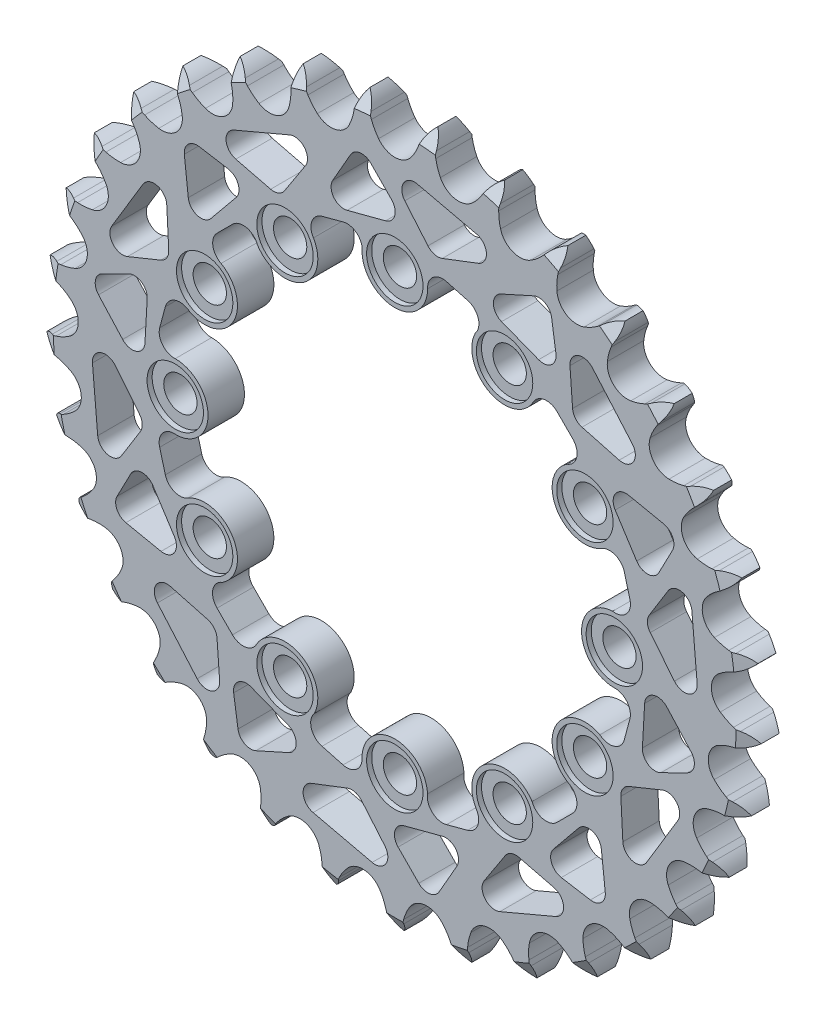
from build123d import *

# Parameters (mm, degrees)
EXTRUSION_DEPTH         = 7.2136
CIRPATTERN1_COUNT       = 12
CUT_EXTRUDE1_DEPTH      = 101.397293257
CUT_EXTRUDE1_DEPTH_BACK = 101.397293257
SKETCH8_R               = 37
CUT_EXTRUDE2_START      = 7.2136
SKETCH10_R              = 5.588
CUT_EXTRUDE2_DEPTH      = 1.016
CIRPATTERN2_COUNT       = 12
CUT_EXTRUDE3_DEPTH      = 101.397293405
CIRPATTERN3_COUNT       = 12
CUT_EXTRUDE4_DEPTH      = 101.397293405
CIRPATTERN5_COUNT       = 10


with BuildPart() as part:
    # Teeth Sketch → Extrusion (new body)
    with BuildSketch(Plane.XY):
        with BuildLine():
            Line((5.022388138, 68.006393031), (4.635162245, 66.971544668))
            ThreePointArc((4.635162245, 66.971544668), (4.0137299, 65.635158722), (3.209237245, 64.400291471))
            ThreePointArc((3.209237245, 64.400291471), (0, 62.793862006), (-3.209237245, 64.400291471))
            ThreePointArc((-3.209237245, 64.400291471), (-4.0137299, 65.635158722), (-4.635162245, 66.971544668))
            Line((-4.635162245, 66.971544668), (-5.022388138, 68.006393031))
            ThreePointArc((-5.022388138, 68.006393031), (-5.727412099, 69.369502295), (-6.734552875, 70.527428506))
            ThreePointArc((-6.734552875, 70.527428506), (-7.504354329, 69.199824885), (-7.938667464, 67.727922119))
            Line((-7.938667464, 67.727922119), (-8.123049341, 66.638491832))
            ThreePointArc((-8.123049341, 66.638491832), (-8.48033889, 65.208649276), (-9.036593151, 63.84384645))
            ThreePointArc((-9.036593151, 63.84384645), (-11.883816523, 61.659095115), (-15.339077445, 62.629142165))
            ThreePointArc((-15.339077445, 62.629142165), (-16.362732034, 63.68944252), (-17.22584699, 64.884071387))
            Line((-17.22584699, 64.884071387), (-17.801921547, 65.826935709))
            ThreePointArc((-17.801921547, 65.826935709), (-18.752174931, 67.031985151), (-19.960254337, 67.978383482))
            ThreePointArc((-19.960254337, 67.978383482), (-20.464893839, 66.529085505), (-20.61279894, 65.001587639))
            Line((-20.61279894, 65.001587639), (-20.587672758, 63.896950277))
            ThreePointArc((-20.587672758, 63.896950277), (-20.667906137, 62.425329346), (-20.955817525, 60.979918474))
            ThreePointArc((-20.955817525, 60.979918474), (-23.338120953, 58.295807876), (-26.914523421, 58.594412483))
            ThreePointArc((-26.914523421, 58.594412483), (-28.120342399, 59.441823925), (-29.193944743, 60.451518712))
            Line((-29.193944743, 60.451518712), (-29.938047129, 61.268321421))
            ThreePointArc((-29.938047129, 61.268321421), (-31.099185303, 62.271757414), (-32.464540202, 62.972422563))
            ThreePointArc((-32.464540202, 62.972422563), (-32.685778765, 61.453811636), (-32.541930156, 59.925926421))
            Line((-32.541930156, 59.925926421), (-32.308204042, 58.846006456))
            ThreePointArc((-32.308204042, 58.846006456), (-32.108481407, 57.385795366), (-32.117644055, 55.912017363))
            ThreePointArc((-32.117644055, 55.912017363), (-33.948924886, 52.825558252), (-37.517208396, 52.441928068))
            ThreePointArc((-37.517208396, 52.441928068), (-38.861610323, 53.045822938), (-40.106897269, 53.834090646))
            Line((-40.106897269, 53.834090646), (-40.992133685, 54.495310364))
            ThreePointArc((-40.992133685, 54.495310364), (-42.32219009, 55.260866117), (-43.795472998, 55.69047422))
            ThreePointArc((-43.795472998, 55.69047422), (-43.725314484, 54.157436897), (-43.294911229, 52.684386087))
            Line((-43.294911229, 52.684386087), (-42.861032653, 51.668214641))
            ThreePointArc((-42.861032653, 51.668214641), (-42.388572501, 50.272189225), (-42.118655247, 48.823310267))
            ThreePointArc((-42.118655247, 48.823310267), (-43.33272622, 45.446055318), (-46.763923708, 44.394055736))
            ThreePointArc((-46.763923708, 44.394055736), (-48.198318397, 44.732607702), (-49.570282031, 45.270958281))
            Line((-49.570282031, 45.270958281), (-50.564657725, 45.752696804))
            ThreePointArc((-50.564657725, 45.752696804), (-52.015560657, 46.252703137), (-53.543523293, 46.395727039))
            ThreePointArc((-53.543523293, 46.395727039), (-53.184503413, 44.903671283), (-52.483101407, 43.538694772))
            Line((-52.483101407, 43.538694772), (-51.864751871, 42.622998928))
            ThreePointArc((-51.864751871, 42.622998928), (-51.136630142, 41.341615182), (-50.597388499, 39.970001531))
            ThreePointArc((-50.597388499, 39.970001531), (-51.150369926, 36.424013535), (-54.320468976, 34.741666562))
            ThreePointArc((-54.320468976, 34.741666562), (-55.793013665, 34.802639473), (-57.242067645, 35.071615531))
            Line((-57.242067645, 35.071615531), (-58.309643291, 35.356461573))
            ThreePointArc((-58.309643291, 35.356461573), (-59.828953337, 35.572846956), (-61.356371149, 35.424117399))
            ThreePointArc((-61.356371149, 35.424117399), (-60.721465817, 34.026969994), (-59.774415556, 32.819401589))
            Line((-59.774415556, 32.819401589), (-58.993943824, 32.037276981))
            ThreePointArc((-58.993943824, 32.037276981), (-58.036476735, 30.916847451), (-57.2474003, 29.672072798))
            ThreePointArc((-57.2474003, 29.672072798), (-57.119305992, 26.085513002), (-59.913730964, 23.83362304))
            ThreePointArc((-59.913730964, 23.83362304), (-61.371204052, 23.614813176), (-62.844975793, 23.604693218))
            Line((-62.844975793, 23.604693218), (-63.947166423, 23.682351702))
            ThreePointArc((-63.947166423, 23.682351702), (-65.479971761, 23.607295402), (-66.951639889, 23.17218786))
            ThreePointArc((-66.951639889, 23.17218786), (-66.063796239, 21.920445353), (-64.905326586, 20.913929722))
            Line((-64.905326586, 20.913929722), (-63.99094094, 20.293644371))
            ThreePointArc((-63.99094094, 20.293644371), (-62.838733846, 19.374664301), (-61.828341898, 18.301718044))
            ThreePointArc((-61.828341898, 18.301718044), (-61.023801517, 14.804214063), (-63.341554612, 12.064170283))
            ThreePointArc((-63.341554612, 12.064170283), (-64.731279223, 11.573486003), (-66.176502774, 11.28463579))
            Line((-66.176502774, 11.28463579), (-67.273472348, 11.152299936))
            ThreePointArc((-67.273472348, 11.152299936), (-68.764373399, 10.788514683), (-70.127101923, 10.082755077))
            ThreePointArc((-70.127101923, 10.082755077), (-69.018408937, 9.021658703), (-67.690390004, 8.252573944))
            Line((-67.690390004, 8.252573944), (-66.675138724, 7.816546579))
            ThreePointArc((-66.675138724, 7.816546579), (-65.369835391, 7.132230303), (-64.174646128, 6.269891516))
            ThreePointArc((-64.174646128, 6.269891516), (-62.722737859, 2.987852256), (-64.480049441, -0.14131302))
            ThreePointArc((-64.480049441, -0.14131302), (-65.751797307, -0.886137108), (-67.116238523, -1.443277777))
            Line((-67.116238523, -1.443277777), (-68.168339704, -1.780825007))
            ThreePointArc((-68.168339704, -1.780825007), (-69.563451418, -2.420191065), (-70.767987779, -3.371094744))
            ThreePointArc((-70.767987779, -3.371094744), (-69.478516511, -4.203194198), (-68.028946362, -4.707051357))
            Line((-68.028946362, -4.707051357), (-66.949523274, -4.943061572))
            ThreePointArc((-66.949523274, -4.943061572), (-65.538300765, -5.367981082), (-64.201511441, -5.988545228))
            ThreePointArc((-64.201511441, -5.988545228), (-62.154711032, -8.936498316), (-63.288067282, -12.341688903))
            ThreePointArc((-63.288067282, -12.341688903), (-64.395874122, -13.313732915), (-65.630218543, -14.119027525))
            Line((-65.630218543, -14.119027525), (-66.599425651, -14.649586294))
            ThreePointArc((-66.599425651, -14.649586294), (-67.848325057, -15.541424803), (-68.851134172, -16.703104419))
            ThreePointArc((-68.851134172, -16.703104419), (-67.427489473, -17.276132709), (-65.908759351, -17.496551559))
            Line((-65.908759351, -17.496551559), (-64.804177617, -17.524014599))
            ThreePointArc((-64.804177617, -17.524014599), (-63.338041192, -17.674179644), (-61.907966855, -18.030540344))
            ThreePointArc((-61.907966855, -18.030540344), (-59.340251006, -20.537860555), (-59.808689476, -24.096003993))
            ThreePointArc((-59.808689476, -24.096003993), (-60.712516265, -25.260135726), (-61.772151467, -26.284478831))
            Line((-61.772151467, -26.284478831), (-62.623434833, -26.988873364))
            ThreePointArc((-62.623434833, -26.988873364), (-63.680983452, -28.100950955), (-64.445821187, -29.43142038))
            ThreePointArc((-64.445821187, -29.43142038), (-62.939457285, -29.724666771), (-61.406458053, -29.6536808))
            Line((-61.406458053, -29.6536808), (-60.316640136, -29.471604079))
            ThreePointArc((-60.316640136, -29.471604079), (-58.848579784, -29.341587304), (-57.376907048, -29.420864754))
            ThreePointArc((-57.376907048, -29.420864754), (-54.381079699, -31.396931003), (-54.167669802, -34.979426717))
            ThreePointArc((-54.167669802, -34.979426717), (-54.834849884, -36.293571418), (-55.681477891, -37.499940589))
            Line((-55.681477891, -37.499940589), (-56.384069915, -38.352712231))
            ThreePointArc((-56.384069915, -38.352712231), (-57.212045185, -39.644835523), (-57.711268312, -41.096008126))
            ThreePointArc((-57.711268312, -41.096008126), (-56.176629123, -41.09887393), (-54.684767369, -40.739048756))
            Line((-54.684767369, -40.739048756), (-53.649102126, -40.354013001))
            ThreePointArc((-53.649102126, -40.354013001), (-52.232177374, -39.94851355), (-50.772096325, -39.747842457))
            ThreePointArc((-50.772096325, -39.747842457), (-47.456434483, -41.12123456), (-46.56888941, -44.598601821))
            ThreePointArc((-46.56888941, -44.598601821), (-46.975309158, -46.015262876), (-47.578330627, -47.360056788))
            Line((-47.578330627, -47.360056788), (-48.106837804, -48.330384151))
            ThreePointArc((-48.106837804, -48.330384151), (-48.675314541, -49.755852442), (-48.890879835, -51.275279063))
            ThreePointArc((-48.890879835, -51.275279063), (-47.383431219, -50.987660703), (-45.986626711, -50.352001344))
            Line((-45.986626711, -50.352001344), (-45.042545785, -49.777922752))
            ThreePointArc((-45.042545785, -49.777922752), (-43.727967985, -49.111596431), (-42.332249756, -48.638229571))
            ThreePointArc((-42.332249756, -48.638229571), (-38.816590078, -49.35930956), (-37.28698802, -52.605867255))
            ThreePointArc((-37.28698802, -52.605867255), (-37.417958367, -54.073842843), (-37.75557853, -55.50845714))
            Line((-37.75557853, -55.50845714), (-38.090899233, -56.561270064))
            ThreePointArc((-38.090899233, -56.561270064), (-38.379331208, -58.068563217), (-38.303447577, -59.601327819))
            ThreePointArc((-38.303447577, -59.601327819), (-36.877672653, -59.03362057), (-35.626409548, -58.145101414))
            Line((-35.626409548, -58.145101414), (-34.808034481, -57.402728679))
            ThreePointArc((-34.808034481, -57.402728679), (-33.6433159, -56.499658259), (-32.362405386, -55.770704343))
            ThreePointArc((-32.362405386, -55.770704343), (-28.773812973, -55.813410509), (-26.657437732, -58.711819583))
            ThreePointArc((-26.657437732, -58.711819583), (-26.508225068, -60.178053241), (-26.568241455, -61.650637225))
            Line((-26.568241455, -61.650637225), (-26.69825632, -62.747884308))
            ThreePointArc((-26.69825632, -62.747884308), (-26.696218847, -64.28252482), (-26.331628924, -65.773229298))
            ThreePointArc((-26.331628924, -65.773229298), (-25.039058915, -64.94595158), (-23.978561119, -63.836686022))
            Line((-23.978561119, -63.836686022), (-23.31547012, -62.952850431))
            ThreePointArc((-23.31547012, -62.952850431), (-22.342706722, -61.845675228), (-21.222899365, -60.887480551))
            ThreePointArc((-21.222899365, -60.887480551), (-17.691075297, -60.250269381), (-15.06441819, -62.69577378))
            ThreePointArc((-15.06441819, -62.69577378), (-14.640415448, -64.107272002), (-14.42065891, -65.564602652))
            Line((-14.42065891, -65.564602652), (-14.340668861, -66.666626525))
            ThreePointArc((-14.340668861, -66.666626525), (-14.048235582, -68.17314849), (-13.408116596, -69.567914899))
            ThreePointArc((-13.408116596, -69.567914899), (-12.295468348, -68.510966685), (-11.464065017, -67.221046473))
            Line((-11.464065017, -67.221046473), (-10.980223921, -66.227692145))
            ThreePointArc((-10.980223921, -66.227692145), (-10.23457391, -64.956428358), (-9.316342465, -63.80362457))
            ThreePointArc((-9.316342465, -63.80362457), (-5.968936066, -62.509526537), (-2.926931324, -64.413739359))
            ThreePointArc((-2.926931324, -64.413739359), (-2.24346307, -65.719486924), (-1.751876179, -67.108892511))
            Line((-1.751876179, -67.108892511), (-1.464772265, -68.175863162))
            ThreePointArc((-1.464772265, -68.175863162), (-0.89251248, -69.59981695), (0, -70.848234798))
            ThreePointArc((0, -70.848234798), (0.89251248, -69.59981695), (1.464772265, -68.175863162))
            Line((1.464772265, -68.175863162), (1.751876179, -67.108892511))
            ThreePointArc((1.751876179, -67.108892511), (2.24346307, -65.719486924), (2.926931324, -64.413739359))
            ThreePointArc((2.926931324, -64.413739359), (5.968936066, -62.509526537), (9.316342465, -63.80362457))
            ThreePointArc((9.316342465, -63.80362457), (10.23457391, -64.956428358), (10.980223921, -66.227692145))
            Line((10.980223921, -66.227692145), (11.464065017, -67.221046473))
            ThreePointArc((11.464065017, -67.221046473), (12.295468348, -68.510966685), (13.408116596, -69.567914899))
            ThreePointArc((13.408116596, -69.567914899), (14.048235582, -68.17314849), (14.340668861, -66.666626525))
            Line((14.340668861, -66.666626525), (14.42065891, -65.564602652))
            ThreePointArc((14.42065891, -65.564602652), (14.640415448, -64.107272002), (15.06441819, -62.69577378))
            ThreePointArc((15.06441819, -62.69577378), (17.691075297, -60.250269381), (21.222899365, -60.887480551))
            ThreePointArc((21.222899365, -60.887480551), (22.342706722, -61.845675228), (23.31547012, -62.952850431))
            Line((23.31547012, -62.952850431), (23.978561119, -63.836686022))
            ThreePointArc((23.978561119, -63.836686022), (25.039058915, -64.94595158), (26.331628924, -65.773229298))
            ThreePointArc((26.331628924, -65.773229298), (26.696218847, -64.28252482), (26.69825632, -62.747884308))
            Line((26.69825632, -62.747884308), (26.568241455, -61.650637225))
            ThreePointArc((26.568241455, -61.650637225), (26.508225068, -60.178053241), (26.657437732, -58.711819583))
            ThreePointArc((26.657437732, -58.711819583), (28.773812973, -55.813410509), (32.362405386, -55.770704343))
            ThreePointArc((32.362405386, -55.770704343), (33.6433159, -56.499658259), (34.808034481, -57.402728679))
            Line((34.808034481, -57.402728679), (35.626409548, -58.145101414))
            ThreePointArc((35.626409548, -58.145101414), (36.877672653, -59.03362057), (38.303447577, -59.601327819))
            ThreePointArc((38.303447577, -59.601327819), (38.379331208, -58.068563217), (38.090899233, -56.561270064))
            Line((38.090899233, -56.561270064), (37.75557853, -55.50845714))
            ThreePointArc((37.75557853, -55.50845714), (37.417958367, -54.073842843), (37.28698802, -52.605867255))
            ThreePointArc((37.28698802, -52.605867255), (38.816590078, -49.35930956), (42.332249756, -48.638229571))
            ThreePointArc((42.332249756, -48.638229571), (43.727967985, -49.111596431), (45.042545785, -49.777922752))
            Line((45.042545785, -49.777922752), (45.986626711, -50.352001344))
            ThreePointArc((45.986626711, -50.352001344), (47.383431219, -50.987660703), (48.890879835, -51.275279063))
            ThreePointArc((48.890879835, -51.275279063), (48.675314541, -49.755852442), (48.106837804, -48.330384151))
            Line((48.106837804, -48.330384151), (47.578330627, -47.360056788))
            ThreePointArc((47.578330627, -47.360056788), (46.975309158, -46.015262876), (46.56888941, -44.598601821))
            ThreePointArc((46.56888941, -44.598601821), (47.456434483, -41.12123456), (50.772096325, -39.747842457))
            ThreePointArc((50.772096325, -39.747842457), (52.232177374, -39.94851355), (53.649102126, -40.354013001))
            Line((53.649102126, -40.354013001), (54.684767369, -40.739048756))
            ThreePointArc((54.684767369, -40.739048756), (56.176629123, -41.09887393), (57.711268312, -41.096008126))
            ThreePointArc((57.711268312, -41.096008126), (57.212045185, -39.644835523), (56.384069915, -38.352712231))
            Line((56.384069915, -38.352712231), (55.681477891, -37.499940589))
            ThreePointArc((55.681477891, -37.499940589), (54.834849884, -36.293571418), (54.167669802, -34.979426717))
            ThreePointArc((54.167669802, -34.979426717), (54.381079699, -31.396931003), (57.376907048, -29.420864754))
            ThreePointArc((57.376907048, -29.420864754), (58.848579784, -29.341587304), (60.316640136, -29.471604079))
            Line((60.316640136, -29.471604079), (61.406458053, -29.6536808))
            ThreePointArc((61.406458053, -29.6536808), (62.939457285, -29.724666771), (64.445821187, -29.43142038))
            ThreePointArc((64.445821187, -29.43142038), (63.680983452, -28.100950955), (62.623434833, -26.988873364))
            Line((62.623434833, -26.988873364), (61.772151467, -26.284478831))
            ThreePointArc((61.772151467, -26.284478831), (60.712516265, -25.260135726), (59.808689476, -24.096003993))
            ThreePointArc((59.808689476, -24.096003993), (59.340251006, -20.537860555), (61.907966855, -18.030540344))
            ThreePointArc((61.907966855, -18.030540344), (63.338041192, -17.674179644), (64.804177617, -17.524014599))
            Line((64.804177617, -17.524014599), (65.908759351, -17.496551559))
            ThreePointArc((65.908759351, -17.496551559), (67.427489473, -17.276132709), (68.851134172, -16.703104419))
            ThreePointArc((68.851134172, -16.703104419), (67.848325057, -15.541424803), (66.599425651, -14.649586294))
            Line((66.599425651, -14.649586294), (65.630218543, -14.119027525))
            ThreePointArc((65.630218543, -14.119027525), (64.395874122, -13.313732915), (63.288067282, -12.341688903))
            ThreePointArc((63.288067282, -12.341688903), (62.154711032, -8.936498316), (64.201511441, -5.988545228))
            ThreePointArc((64.201511441, -5.988545228), (65.538300765, -5.367981082), (66.949523274, -4.943061572))
            Line((66.949523274, -4.943061572), (68.028946362, -4.707051357))
            ThreePointArc((68.028946362, -4.707051357), (69.478516511, -4.203194198), (70.767987779, -3.371094744))
            ThreePointArc((70.767987779, -3.371094744), (69.563451418, -2.420191065), (68.168339704, -1.780825007))
            Line((68.168339704, -1.780825007), (67.116238523, -1.443277777))
            ThreePointArc((67.116238523, -1.443277777), (65.751797307, -0.886137108), (64.480049441, -0.14131302))
            ThreePointArc((64.480049441, -0.14131302), (62.722737859, 2.987852256), (64.174646128, 6.269891516))
            ThreePointArc((64.174646128, 6.269891516), (65.369835391, 7.132230303), (66.675138724, 7.816546579))
            Line((66.675138724, 7.816546579), (67.690390004, 8.252573944))
            ThreePointArc((67.690390004, 8.252573944), (69.018408937, 9.021658703), (70.127101923, 10.082755077))
            ThreePointArc((70.127101923, 10.082755077), (68.764373399, 10.788514683), (67.273472348, 11.152299936))
            Line((67.273472348, 11.152299936), (66.176502774, 11.28463579))
            ThreePointArc((66.176502774, 11.28463579), (64.731279223, 11.573486003), (63.341554612, 12.064170283))
            ThreePointArc((63.341554612, 12.064170283), (61.023801517, 14.804214063), (61.828341898, 18.301718044))
            ThreePointArc((61.828341898, 18.301718044), (62.838733846, 19.374664301), (63.99094094, 20.293644371))
            Line((63.99094094, 20.293644371), (64.905326586, 20.913929722))
            ThreePointArc((64.905326586, 20.913929722), (66.063796239, 21.920445353), (66.951639889, 23.17218786))
            ThreePointArc((66.951639889, 23.17218786), (65.479971761, 23.607295402), (63.947166423, 23.682351702))
            Line((63.947166423, 23.682351702), (62.844975793, 23.604693218))
            ThreePointArc((62.844975793, 23.604693218), (61.371204052, 23.614813176), (59.913730964, 23.83362304))
            ThreePointArc((59.913730964, 23.83362304), (57.119305992, 26.085513002), (57.2474003, 29.672072798))
            ThreePointArc((57.2474003, 29.672072798), (58.036476735, 30.916847451), (58.993943824, 32.037276981))
            Line((58.993943824, 32.037276981), (59.774415556, 32.819401589))
            ThreePointArc((59.774415556, 32.819401589), (60.721465817, 34.026969994), (61.356371149, 35.424117399))
            ThreePointArc((61.356371149, 35.424117399), (59.828953337, 35.572846956), (58.309643291, 35.356461573))
            Line((58.309643291, 35.356461573), (57.242067645, 35.071615531))
            ThreePointArc((57.242067645, 35.071615531), (55.793013665, 34.802639473), (54.320468976, 34.741666562))
            ThreePointArc((54.320468976, 34.741666562), (51.150369926, 36.424013535), (50.597388499, 39.970001531))
            ThreePointArc((50.597388499, 39.970001531), (51.136630142, 41.341615182), (51.864751871, 42.622998928))
            Line((51.864751871, 42.622998928), (52.483101407, 43.538694772))
            ThreePointArc((52.483101407, 43.538694772), (53.184503413, 44.903671283), (53.543523293, 46.395727039))
            ThreePointArc((53.543523293, 46.395727039), (52.015560657, 46.252703137), (50.564657725, 45.752696804))
            Line((50.564657725, 45.752696804), (49.570282031, 45.270958281))
            ThreePointArc((49.570282031, 45.270958281), (48.198318397, 44.732607702), (46.763923708, 44.394055736))
            ThreePointArc((46.763923708, 44.394055736), (43.33272622, 45.446055318), (42.118655247, 48.823310267))
            ThreePointArc((42.118655247, 48.823310267), (42.388572501, 50.272189225), (42.861032653, 51.668214641))
            Line((42.861032653, 51.668214641), (43.294911229, 52.684386087))
            ThreePointArc((43.294911229, 52.684386087), (43.725314484, 54.157436897), (43.795472998, 55.69047422))
            ThreePointArc((43.795472998, 55.69047422), (42.32219009, 55.260866117), (40.992133685, 54.495310364))
            Line((40.992133685, 54.495310364), (40.106897269, 53.834090646))
            ThreePointArc((40.106897269, 53.834090646), (38.861610323, 53.045822938), (37.517208396, 52.441928068))
            ThreePointArc((37.517208396, 52.441928068), (33.948924886, 52.825558252), (32.117644055, 55.912017363))
            ThreePointArc((32.117644055, 55.912017363), (32.108481407, 57.385795366), (32.308204042, 58.846006456))
            Line((32.308204042, 58.846006456), (32.541930156, 59.925926421))
            ThreePointArc((32.541930156, 59.925926421), (32.685778765, 61.453811636), (32.464540202, 62.972422563))
            ThreePointArc((32.464540202, 62.972422563), (31.099185303, 62.271757414), (29.938047129, 61.268321421))
            Line((29.938047129, 61.268321421), (29.193944743, 60.451518712))
            ThreePointArc((29.193944743, 60.451518712), (28.120342399, 59.441823925), (26.914523421, 58.594412483))
            ThreePointArc((26.914523421, 58.594412483), (23.338120953, 58.295807876), (20.955817525, 60.979918474))
            ThreePointArc((20.955817525, 60.979918474), (20.667906137, 62.425329346), (20.587672758, 63.896950277))
            Line((20.587672758, 63.896950277), (20.61279894, 65.001587639))
            ThreePointArc((20.61279894, 65.001587639), (20.464893839, 66.529085505), (19.960254337, 67.978383482))
            ThreePointArc((19.960254337, 67.978383482), (18.752174931, 67.031985151), (17.801921547, 65.826935709))
            Line((17.801921547, 65.826935709), (17.22584699, 64.884071387))
            ThreePointArc((17.22584699, 64.884071387), (16.362732034, 63.68944252), (15.339077445, 62.629142165))
            ThreePointArc((15.339077445, 62.629142165), (11.883816523, 61.659095115), (9.036593151, 63.84384645))
            ThreePointArc((9.036593151, 63.84384645), (8.48033889, 65.208649276), (8.123049341, 66.638491832))
            Line((8.123049341, 66.638491832), (7.938667464, 67.727922119))
            ThreePointArc((7.938667464, 67.727922119), (7.504354329, 69.199824885), (6.734552875, 70.527428506))
            ThreePointArc((6.734552875, 70.527428506), (5.727412099, 69.369502295), (5.022388138, 68.006393031))
        make_face()
    extrude(amount=EXTRUSION_DEPTH)

    # Sketch7 → M6 Clearance Hole1 (revolve, cut)
    with BuildSketch(Plane(origin=(0, 43.500000122, 0), x_dir=(0, 1, 0), z_dir=(1, 0, 0))):
        Polygon((0, 0), (0, 19.254840043), (3.3, 17.272), (3.3, 0), align=None)
    m6_clearance_hole1 = revolve(axis=Axis((0, 43.500000122, -6.35), (0, 0, 1)), mode=Mode.SUBTRACT)

    # CirPattern1: M6 Clearance Hole1 ×12 about axis
    cirpattern1_axis = Axis((0, 0, 0), (0, 0, 1))
    for i in range(1, CIRPATTERN1_COUNT):
        add(m6_clearance_hole1.rotate(cirpattern1_axis, i * 360 / CIRPATTERN1_COUNT), mode=Mode.SUBTRACT)

    # Sketch8 → Cut-Extrude1 (cut, two sides: drawn at the far end of the back side and taken through both)
    with BuildSketch(Plane(origin=(0, 0, 0), x_dir=(-1, 0, 0), z_dir=(0, 0, -1)).offset(-CUT_EXTRUDE1_DEPTH_BACK)):
        Circle(SKETCH8_R)
    extrude(amount=CUT_EXTRUDE1_DEPTH + CUT_EXTRUDE1_DEPTH_BACK, mode=Mode.SUBTRACT)

    # Sketch5 → Cut-Revolve1 (revolve, cut)
    with BuildSketch(Plane(origin=(0, 0, 0), x_dir=(0, 0, -1), z_dir=(1, 0, 0))):
        Polygon((-7.2136, -67.654652666), (-7.2136, -70.848234798), (-5.3848, -70.848234798), align=None)
    cut_revolve1 = revolve(axis=Axis((0, 0, 7.2136), (0, 0, -1)), mode=Mode.SUBTRACT)

    # Mirror1: Cut-Revolve1 across plane
    add(cut_revolve1.mirror(Plane.XY.offset(3.6068)), mode=Mode.SUBTRACT)

    # Sketch10 → Cut-Extrude2 (cut)
    with BuildSketch(Plane.XY.offset(CUT_EXTRUDE2_START)):
        with Locations((-43.500000122, 0)):
            Circle(SKETCH10_R)
    cut_extrude2 = extrude(amount=-CUT_EXTRUDE2_DEPTH, mode=Mode.SUBTRACT)

    # CirPattern2: Cut-Extrude2 ×12 about axis
    cirpattern2_axis = Axis((0, 0, 0), (0, 0, 1))
    for i in range(1, CIRPATTERN2_COUNT):
        add(cut_extrude2.rotate(cirpattern2_axis, i * 360 / CIRPATTERN2_COUNT), mode=Mode.SUBTRACT)

    # Sketch12 → Cut-Extrude3 (cut, through all)
    with BuildSketch(Plane.XY.offset(7.2136)):
        with BuildLine():
            Line((10.247557334, 46.58614006), (14.418425052, 45.468559424))
            ThreePointArc((14.418425052, 45.468559424), (16.52512006, 43.476131789), (15.962793017, 40.631536909))
            ThreePointArc((15.962793017, 40.631536909), (15.516319163, 35.83057753), (18.5, 32.04293994))
            ThreePointArc((18.5, 32.04293994), (9.576304669, 35.739255573), (0, 37))
            ThreePointArc((0, 37), (4.596194164, 38.903805958), (6.500000122, 43.500000122))
            ThreePointArc((6.500000122, 43.500000122), (7.587792196, 45.997508178), (10.247557334, 46.58614006))
        make_face()
    cut_extrude3 = extrude(amount=-CUT_EXTRUDE3_DEPTH, mode=Mode.SUBTRACT)

    # CirPattern3: Cut-Extrude3 ×12 about axis
    cirpattern3_axis = Axis((0, 0, 0), (0, 0, 1))
    for i in range(1, CIRPATTERN3_COUNT):
        add(cut_extrude3.rotate(cirpattern3_axis, i * 360 / CIRPATTERN3_COUNT), mode=Mode.SUBTRACT)

    # Sketch13 → Cut-Extrude4 (cut, through all)
    with BuildSketch(Plane.XY.offset(7.2136)):
        with BuildLine():
            Line((-12.29503781, 52.699348233), (-8.766956721, 58.874555746))
            ThreePointArc((-8.766956721, 58.874555746), (-6.886929375, 60.133596514), (-4.748676784, 59.393621964))
            Line((-4.748676784, 59.393621964), (-0.656757873, 55.224069994))
            ThreePointArc((-0.656757873, 55.224069994), (-0.020757561, 52.770631729), (-1.823075281, 50.988636624))
            Line((-1.823075281, 50.988636624), (-9.443075281, 48.982981081))
            ThreePointArc((-9.443075281, 48.982981081), (-12.104647123, 49.892965008), (-12.29503781, 52.699348233))
        make_face()
        with BuildLine():
            Line((1.979717897, 56.320855635), (6.567308468, 50.886285113))
            ThreePointArc((6.567308468, 50.886285113), (7.875401815, 50.064805257), (9.417527045, 50.153050025))
            Line((9.417527045, 50.153050025), (16.53250792, 52.880951625))
            ThreePointArc((16.53250792, 52.880951625), (18.15709085, 55.428778294), (16.195570256, 57.727283763))
            Line((16.195570256, 57.727283763), (4.49299881, 60.433952684))
            ThreePointArc((4.49299881, 60.433952684), (1.753234812, 59.28365705), (1.979717897, 56.320855635))
        make_face()
    cut_extrude4 = extrude(amount=-CUT_EXTRUDE4_DEPTH, mode=Mode.SUBTRACT)

    # CirPattern5: Cut-Extrude4 ×10 about axis
    cirpattern5_axis = Axis((0, 0, 0), (0, 0, 1))
    for i in range(1, CIRPATTERN5_COUNT):
        add(cut_extrude4.rotate(cirpattern5_axis, i * 360 / CIRPATTERN5_COUNT), mode=Mode.SUBTRACT)


solid = part.part
